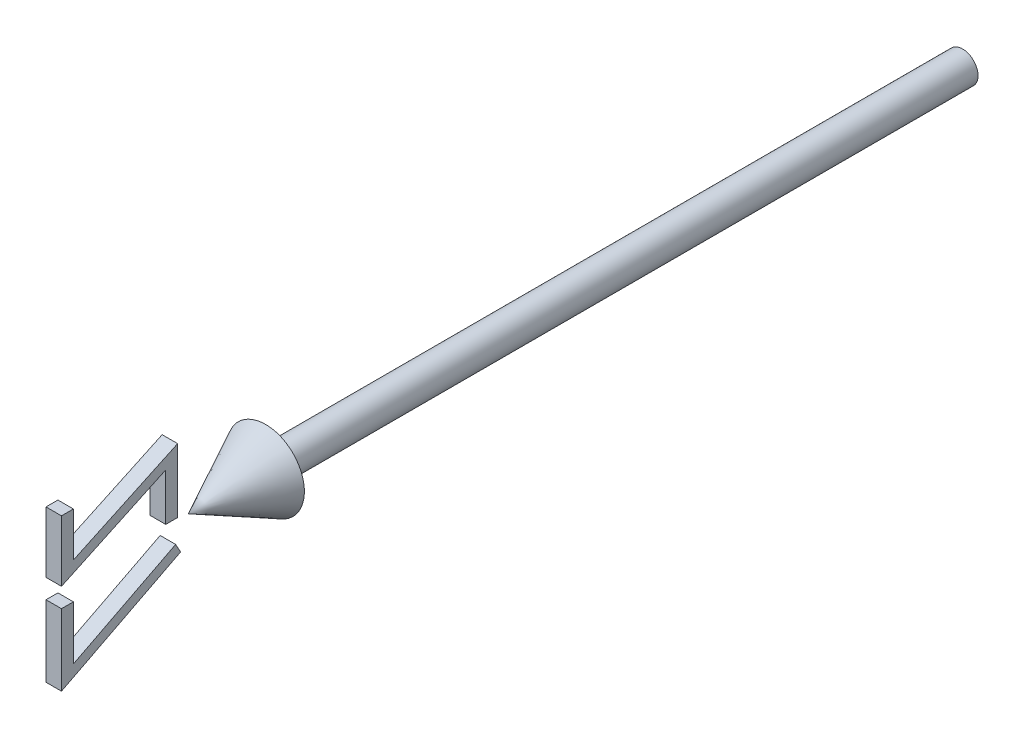
from build123d import *

# Parameters (mm, degrees)
BOSS_EXTRUDE1_DEPTH        = 1
BOSS_EXTRUDE1_DEPTH_BACK   = 1
BOSS_EXTRUDE1_2_DEPTH      = 1
BOSS_EXTRUDE1_2_DEPTH_BACK = 1


with BuildPart() as part:
    # Sketch2 → Revolve1 (revolve)
    with BuildSketch(Plane(origin=(0, 0, 0), x_dir=(1, 0, 0), z_dir=(0, 1, 0))):
        Polygon((0, -100), (5, -90), (2, -90), (2, 0), (0, 0), align=None)
    revolve(axis=Axis((0, 0, -41.949952025), (0, 0, 1)))


with BuildPart() as body_2:
    # Sketch3 → Boss-Extrude1 (new, two sides: drawn at the far end of the back side and taken through both)
    with BuildSketch(Plane(origin=(0, 0, 0), x_dir=(0, -1, 0), z_dir=(1, 0, 0)).offset(-BOSS_EXTRUDE1_DEPTH_BACK)):
        Polygon((-8.958586521, -115.829050545), (-8.958586521, -117.367512083), (-1.073971137, -117.367512083), (-7.366038444, -103.905973622), (-1.266278829, -103.905973622), (-1.266278829, -102.367512083), (-9.535509598, -102.367512083), (-3.243442291, -115.829050545), align=None)
    extrude(amount=BOSS_EXTRUDE1_DEPTH + BOSS_EXTRUDE1_DEPTH_BACK)


with BuildPart() as body_3:
    # Sketch3 → Boss-Extrude1 2 (new, two sides: drawn at the far end of the back side and taken through both)
    with BuildSketch(Plane(origin=(0, 0, 0), x_dir=(0, -1, 0), z_dir=(1, 0, 0)).offset(-BOSS_EXTRUDE1_2_DEPTH_BACK)):
        Polygon((1.426028863, -117.367512083), (10.656798094, -117.367512083), (2.772182709, -101.982896699), (1.609322133, -102.622920737), (8.379153863, -115.829050545), (1.426028863, -115.829050545), align=None)
    extrude(amount=BOSS_EXTRUDE1_2_DEPTH + BOSS_EXTRUDE1_2_DEPTH_BACK)


solid = Compound([part.part, body_2.part, body_3.part])
